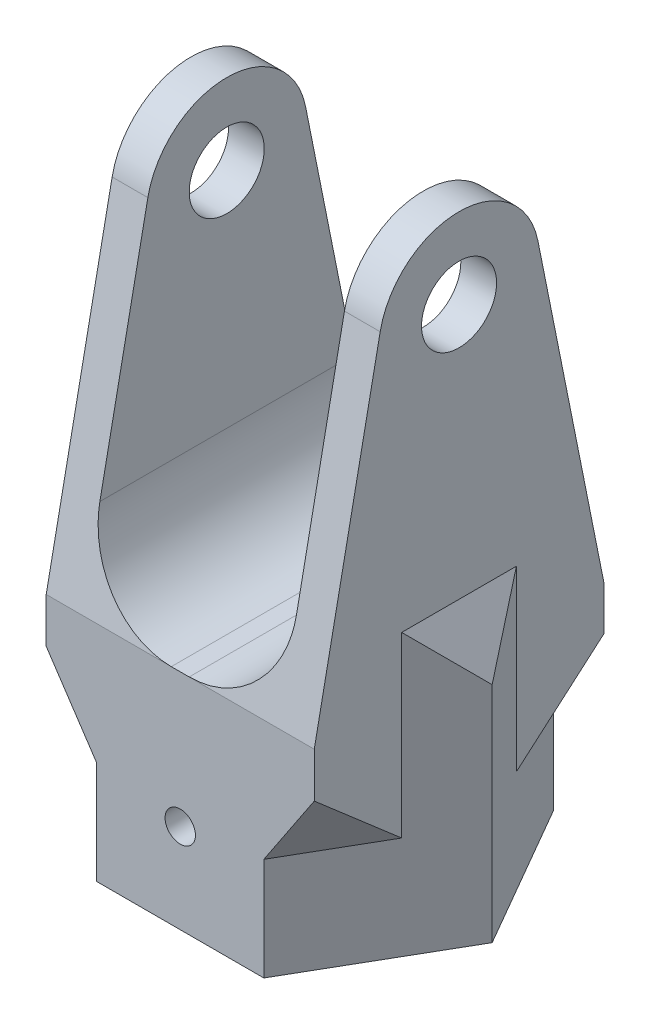
from build123d import *

# Parameters (mm, degrees)
SALIENTE_EXTRUIR1_START = 11
CROQUIS1_R              = 4.2
SALIENTE_EXTRUIR1_DEPTH = 4
SALIENTE_EXTRUIR2_START = -11
CROQUIS1_3_R            = 4.2
SALIENTE_EXTRUIR2_DEPTH = 4
CROQUIS2_R              = 13.1
SALIENTE_EXTRUIR3_DEPTH = 5
CROQUIS2_3_R            = 13.1
SALIENTE_EXTRUIR4_DEPTH = 25
CHAFL_N1_SIZE           = 8.5
CHAFL_N1_SIZE_2         = 4.907477288
CHAFL_N3_SIZE           = 6.42
CHAFL_N3_SIZE_2         = 3.706588728
CHAFL_N4_SIZE           = 6.425908496
CHAFL_N4_SIZE_2         = 3.71
REDONDEO2_R             = 10
CORTAR_EXTRUIR1_REACH   = 59.755
CROQUIS3_R              = 1.7


with BuildPart() as part:
    # Croquis1 → Saliente-Extruir1 (new body)
    with BuildSketch(Plane(origin=(0, 0, 0), x_dir=(0, 0, -1), z_dir=(1, 0, 0)).offset(SALIENTE_EXTRUIR1_START)):
        with BuildLine():
            Line((-16.2, 0), (16.2, 0))
            Line((16.2, 0), (8.824220118, 36.770067598))
            ThreePointArc((8.824220118, 36.770067598), (0, 44), (-8.824220118, 36.770067598))
            Line((-8.824220118, 36.770067598), (-16.2, 0))
        make_face()
        with Locations((0, 35)):
            Circle(CROQUIS1_R, mode=Mode.SUBTRACT)
    extrude(amount=SALIENTE_EXTRUIR1_DEPTH)



with BuildPart() as body_2:
    # Croquis1<3> → Saliente-Extruir2 (new body)
    with BuildSketch(Plane(origin=(0, 0, 0), x_dir=(0, 0, -1), z_dir=(1, 0, 0)).offset(SALIENTE_EXTRUIR2_START)):
        with BuildLine():
            Line((-16.2, 0), (16.2, 0))
            Line((16.2, 0), (8.824220118, 36.770067598))
            ThreePointArc((8.824220118, 36.770067598), (0, 44), (-8.824220118, 36.770067598))
            Line((-8.824220118, 36.770067598), (-16.2, 0))
        make_face()
        with Locations((0, 35)):
            Circle(CROQUIS1_3_R, mode=Mode.SUBTRACT)
    extrude(amount=-SALIENTE_EXTRUIR2_DEPTH)


with BuildPart() as part_1:
    add(part.part)

    add(body_2.part)  # Saliente-Extruir3 merges body 2
    # Croquis2 → Saliente-Extruir3 (add)
    with BuildSketch(Plane(origin=(0, 0, 0), x_dir=(1, 0, 0), z_dir=(0, 1, 0))):
        Polygon((-9.353074361, -16.2), (-15, -6.419237886), (-15, -16.2), align=None)
        Polygon((15, -16.2), (15, -6.419237886), (9.353074361, -16.2), align=None)
        Polygon((15, 16.2), (9.353074361, 16.2), (15, 6.419237886), align=None)
        Polygon((-15, 6.419237886), (-9.353074361, 16.2), (-15, 16.2), align=None)
        with Locations(Location((0, 0, 0), (0, 0, 270))):
            Circle(CROQUIS2_R)
    extrude(amount=-SALIENTE_EXTRUIR3_DEPTH)

    # Croquis2<3> → Saliente-Extruir4 (add)
    with BuildSketch(Plane(origin=(0, 0, 0), x_dir=(1, 0, 0), z_dir=(0, 1, 0))):
        Polygon((9.353074361, -16.2), (18.706148722, 0), (9.353074361, 16.2), (-9.353074361, 16.2), (-18.706148722, 0), (-9.353074361, -16.2), align=None)
        with Locations(Location((0, 0, 0), (0, 0, 270))):
            Circle(CROQUIS2_3_R, mode=Mode.SUBTRACT)
    extrude(amount=-SALIENTE_EXTRUIR4_DEPTH)

    # Chaflán1
    # the kernel refuses this chamfer: 8.5, 4.907477288 mm, written as the material it adds along each edge
    with BuildSketch(Plane(origin=(-1.642040096, -5, -35.244096875), x_dir=(-0.01673746999358639, -0.9998132206222078, 0.00966338280635039), z_dir=(0.5000000000000002, 0, 0.8660254037844386))) as chafl_n1_piece_1_section:
        Polygon((CHAFL_N1_SIZE * 0.999813220622, CHAFL_N1_SIZE * 0.0193267656127), (-CHAFL_N1_SIZE_2 * 0.0193267656131, CHAFL_N1_SIZE_2 * 0.999813220645), (0, 0), align=None)
    chafl_n1_piece_1 = extrude(amount=55.274309107, mode=Mode.PRIVATE)
    chafl_n1_piece_1 = split(chafl_n1_piece_1, bisect_by=Plane(origin=(12.808321649, -8.299879968, -16.2), z_dir=(0, 0, 1)), keep=Keep.TOP, mode=Mode.PRIVATE)
    chafl_n1_piece_1 = split(chafl_n1_piece_1, bisect_by=Plane(origin=(15, -8.299879968, -12.403901743), z_dir=(-1, 0, 0)), keep=Keep.TOP, mode=Mode.PRIVATE)
    add(chafl_n1_piece_1)
    with BuildSketch(Plane(origin=(-25.995114457, -5, 12.624858989), x_dir=(-0.8645728572665671, 0.057893862402670776, -0.4991613718768959), z_dir=(0.49999999999999956, 0, -0.8660254037844389))) as chafl_n1_piece_2_section:
        Polygon((CHAFL_N1_SIZE_2 * 0.998322743777, -CHAFL_N1_SIZE_2 * 0.057893862404), (-CHAFL_N1_SIZE * 0.0578938624027, -CHAFL_N1_SIZE * 0.998322743754), (0, 0), align=None)
    chafl_n1_piece_2 = extrude(amount=55.274309107, mode=Mode.PRIVATE)
    chafl_n1_piece_2 = split(chafl_n1_piece_2, bisect_by=Plane(origin=(-15, -8.299879968, -12.403901743), z_dir=(1, 0, 0)), keep=Keep.TOP, mode=Mode.PRIVATE)
    chafl_n1_piece_2 = split(chafl_n1_piece_2, bisect_by=Plane(origin=(-12.808321649, -8.299879968, -16.2), z_dir=(0, 0, 1)), keep=Keep.TOP, mode=Mode.PRIVATE)
    add(chafl_n1_piece_2)
    with BuildSketch(Plane(origin=(1.642040096, -5, 35.244096875), x_dir=(0.016737469993586364, -0.9998132206222078, -0.00966338280635038), z_dir=(-0.5000000000000004, 0, -0.8660254037844385))) as chafl_n1_piece_3_section:
        Polygon((CHAFL_N1_SIZE * 0.999813220622, CHAFL_N1_SIZE * 0.0193267656127), (-CHAFL_N1_SIZE_2 * 0.0193267656131, CHAFL_N1_SIZE_2 * 0.999813220645), (0, 0), align=None)
    chafl_n1_piece_3 = extrude(amount=55.274309107, mode=Mode.PRIVATE)
    chafl_n1_piece_3 = split(chafl_n1_piece_3, bisect_by=Plane(origin=(-15, -8.299879968, 12.403901743), z_dir=(1, 0, 0)), keep=Keep.TOP, mode=Mode.PRIVATE)
    chafl_n1_piece_3 = split(chafl_n1_piece_3, bisect_by=Plane(origin=(-12.808321649, -8.299879968, 16.2), z_dir=(0, 0, -1)), keep=Keep.TOP, mode=Mode.PRIVATE)
    add(chafl_n1_piece_3)
    with BuildSketch(Plane(origin=(25.995114457, -5, -12.624858989), x_dir=(-0.016737469993586725, -0.9998132206222078, -0.009663382806350568), z_dir=(-0.4999999999999995, 0, 0.8660254037844389))) as chafl_n1_piece_4_section:
        Polygon((CHAFL_N1_SIZE * 0.999813220622, CHAFL_N1_SIZE * 0.0193267656127), (-CHAFL_N1_SIZE_2 * 0.0193267656131, CHAFL_N1_SIZE_2 * 0.999813220645), (0, 0), align=None)
    chafl_n1_piece_4 = extrude(amount=55.274309107, mode=Mode.PRIVATE)
    chafl_n1_piece_4 = split(chafl_n1_piece_4, bisect_by=Plane(origin=(15, -8.299879968, 12.403901743), z_dir=(-1, 0, 0)), keep=Keep.TOP, mode=Mode.PRIVATE)
    chafl_n1_piece_4 = split(chafl_n1_piece_4, bisect_by=Plane(origin=(12.808321649, -8.299879968, 16.2), z_dir=(0, 0, -1)), keep=Keep.TOP, mode=Mode.PRIVATE)
    add(chafl_n1_piece_4)

    # Chaflán3
    # the kernel refuses this chamfer: 6.42, 3.706588728 mm, written as the material it adds along each edge
    with BuildSketch(Plane(origin=(-15, 0, 23.028328431), x_dir=(0.019326765612700848, 0.9998132206222079, 0), z_dir=(0, 0, -1))) as chafl_n3_piece_1_section:
        Polygon((CHAFL_N3_SIZE * 0.999813220622, -CHAFL_N3_SIZE * 0.0193267656127), (-CHAFL_N3_SIZE_2 * 0.0193267656137, -CHAFL_N3_SIZE_2 * 0.999813220675), (0, 0), align=None)
    chafl_n3_piece_1 = extrude(amount=46.056656863, mode=Mode.PRIVATE)
    chafl_n3_piece_1 = split(chafl_n3_piece_1, bisect_by=Plane(origin=(-17.986677842, 2.490730723, 1.246160118), z_dir=(0.8660254037844385, 0, -0.5000000000000004)), keep=Keep.TOP, mode=Mode.PRIVATE)
    chafl_n3_piece_1 = split(chafl_n3_piece_1, bisect_by=Plane(origin=(-17.986677842, 2.490730723, -1.246160118), z_dir=(0.8660254037844389, 0, 0.4999999999999996)), keep=Keep.TOP, mode=Mode.PRIVATE)
    add(chafl_n3_piece_1)

    # Chaflán4
    # the kernel refuses this chamfer: 6.425908496, 3.71 mm, written as the material it adds along each edge
    with BuildSketch(Plane(origin=(15, 0, 23.043614217), x_dir=(-0.019326765612700598, 0.9998132206222079, 0), z_dir=(0, 0, -1))) as chafl_n4_piece_1_section:
        Polygon((CHAFL_N4_SIZE * 0.999813220635, CHAFL_N4_SIZE * 0.0193267656129), (-CHAFL_N4_SIZE_2 * 0.0193267656127, CHAFL_N4_SIZE_2 * 0.999813220622), (0, 0), align=None)
    chafl_n4_piece_1 = extrude(amount=46.087228435, mode=Mode.PRIVATE)
    chafl_n4_piece_1 = split(chafl_n4_piece_1, bisect_by=Plane(origin=(17.986748418, 2.493472797, -1.246037877), z_dir=(-0.8660254037844386, 0, 0.5000000000000003)), keep=Keep.TOP, mode=Mode.PRIVATE)
    chafl_n4_piece_1 = split(chafl_n4_piece_1, bisect_by=Plane(origin=(17.986748418, 2.493472797, 1.246037877), z_dir=(-0.8660254037844389, 0, -0.4999999999999996)), keep=Keep.TOP, mode=Mode.PRIVATE)
    add(chafl_n4_piece_1)

    # Redondeo2
    redondeo2_edges = [part_1.edges().sort_by_distance(p)[0] for p in [
        (-11, 0, 0),
        (11, 0, 0),
    ]]
    fillet(redondeo2_edges, radius=REDONDEO2_R)

    # Cortar-Extruir1: up to this face of the body (flat: up to its plane)
    cortar_extruir1_end = Plane(part_1.part.faces().sort_by_distance((0, -11.120511865, -16.2))[0])
    # Croquis3 → Cortar-Extruir1 (cut, up to the picked face)
    with BuildSketch(Plane.XY.offset(16.2), mode=Mode.PRIVATE) as cortar_extruir1_sk1:
        with Locations((0, -15)):
            Circle(CROQUIS3_R)
    cortar_extruir1_tool1 = split(extrude(cortar_extruir1_sk1.sketch, amount=-CORTAR_EXTRUIR1_REACH, mode=Mode.PRIVATE), bisect_by=cortar_extruir1_end, keep=Keep.BOTH, mode=Mode.PRIVATE)
    add(cortar_extruir1_tool1.solids().sort_by(Axis((0, -15, 16.2), (0, 0, -1)))[0], mode=Mode.SUBTRACT)


solid = part_1.part
